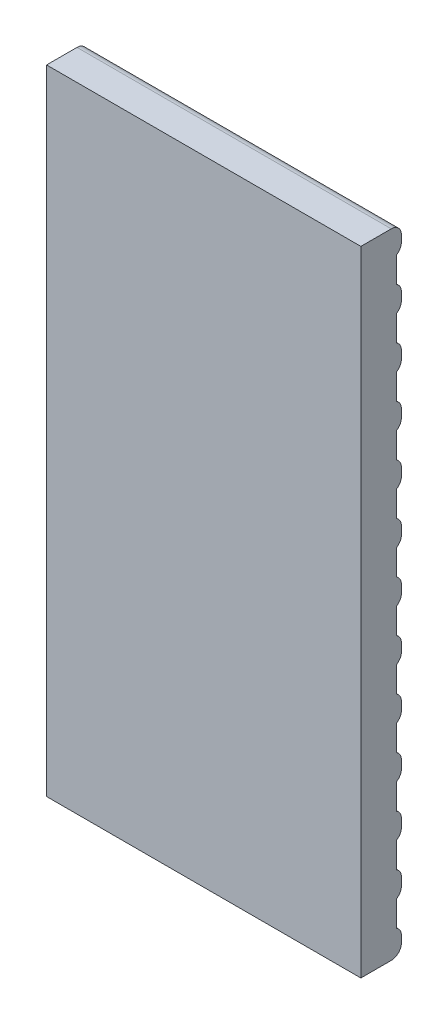
from build123d import *

# Parameters (mm, degrees)
SKETCH1_W           = 15.748
SKETCH1_H           = 31.75
BOSS_EXTRUDE1_DEPTH = 1.778
SKETCH2_W           = 15.748
SKETCH2_H           = 1.27
BOSS_EXTRUDE2_DEPTH = 0.254
FILLET1_R           = 0.508


with BuildPart() as part:
    # Sketch1 → Boss-Extrude1 (new body)
    with BuildSketch(Plane.XY):
        Rectangle(SKETCH1_W, SKETCH1_H)
    extrude(amount=BOSS_EXTRUDE1_DEPTH)

    # Sketch2 → Boss-Extrude2 (add)
    with BuildSketch(Plane(origin=(0, 0, 0), x_dir=(-1, 0, 0), z_dir=(0, 0, -1))):
        with Locations((0, -15.24)):
            Rectangle(SKETCH2_W, SKETCH2_H)
        with Locations((0, -12.7)):
            Rectangle(SKETCH2_W, SKETCH2_H)
        with Locations((0, -10.16)):
            Rectangle(SKETCH2_W, SKETCH2_H)
        with Locations((0, -7.62)):
            Rectangle(SKETCH2_W, SKETCH2_H)
        with Locations((0, -5.08)):
            Rectangle(SKETCH2_W, SKETCH2_H)
        with Locations((0, -2.54)):
            Rectangle(SKETCH2_W, SKETCH2_H)
        Rectangle(SKETCH2_W, SKETCH2_H)
        with Locations((0, 2.54)):
            Rectangle(SKETCH2_W, SKETCH2_H)
        with Locations((0, 5.08)):
            Rectangle(SKETCH2_W, SKETCH2_H)
        with Locations((0, 7.62)):
            Rectangle(SKETCH2_W, SKETCH2_H)
        with Locations((0, 10.16)):
            Rectangle(SKETCH2_W, SKETCH2_H)
        with Locations((0, 12.7)):
            Rectangle(SKETCH2_W, SKETCH2_H)
        with Locations((0, 15.24)):
            Rectangle(SKETCH2_W, SKETCH2_H)
    extrude(amount=BOSS_EXTRUDE2_DEPTH)

    # Fillet1
    # the kernel refuses this fillet: 0.508 mm, written as the material it takes off along each edge
    with BuildSketch(Plane(origin=(9.144, 15.875, -0.254), x_dir=(0, 0, 1), z_dir=(-1, 0, 0))) as fillet1_piece_1:
        with BuildLine():
            CenterArc((FILLET1_R, -FILLET1_R), FILLET1_R, 90, 90)
            Line((0, -FILLET1_R), (-FILLET1_R * 0.02, -FILLET1_R))
            Line((-FILLET1_R * 0.02, -FILLET1_R), (-FILLET1_R * 0.02, FILLET1_R * 0.02))
            Line((-FILLET1_R * 0.02, FILLET1_R * 0.02), (FILLET1_R, FILLET1_R * 0.02))
            Line((FILLET1_R, FILLET1_R * 0.02), (FILLET1_R, 0))
        make_face()
    extrude(amount=18.288, mode=Mode.SUBTRACT)
    with BuildSketch(Plane(origin=(-8.973852263, 14.605, -0.254), x_dir=(0, 0, 1), z_dir=(1, 0, 0)), Plane(origin=(-8.973852263, 12.065, -0.254), x_dir=(0, 0, 1), z_dir=(1, 0, 0)), Plane(origin=(-8.973852263, 9.525, -0.254), x_dir=(0, 0, 1), z_dir=(1, 0, 0)), Plane(origin=(-8.973852263, 6.985, -0.254), x_dir=(0, 0, 1), z_dir=(1, 0, 0)), Plane(origin=(-8.973852263, 4.445, -0.254), x_dir=(0, 0, 1), z_dir=(1, 0, 0)), Plane(origin=(-8.973852263, 1.905, -0.254), x_dir=(0, 0, 1), z_dir=(1, 0, 0)), Plane(origin=(-8.973852263, -0.635, -0.254), x_dir=(0, 0, 1), z_dir=(1, 0, 0)), Plane(origin=(-8.973852263, -3.175, -0.254), x_dir=(0, 0, 1), z_dir=(1, 0, 0)), Plane(origin=(-8.973852263, -5.715, -0.254), x_dir=(0, 0, 1), z_dir=(1, 0, 0)), Plane(origin=(-8.973852263, -8.255, -0.254), x_dir=(0, 0, 1), z_dir=(1, 0, 0)), Plane(origin=(-8.973852263, -10.795, -0.254), x_dir=(0, 0, 1), z_dir=(1, 0, 0)), Plane(origin=(-8.973852263, -13.335, -0.254), x_dir=(0, 0, 1), z_dir=(1, 0, 0))) as fillet1_piece_2:
        with BuildLine():
            CenterArc((0.508, -0.439940905), FILLET1_R, 120, 60)
            Line((0, -0.439940905), (-0.01016, -0.439940905))
            Line((-0.01016, -0.439940905), (-0.01016, 0))
            Line((-0.01016, 0), (0, 0.01016))
            ThreePointArc((0, 0.01016), (0.127, 0.01016), (0.24892, 0.008798818))
            Line((0.24892, 0.008798818), (0.254, 0))
        make_face()
    extrude(amount=17.947704526, mode=Mode.SUBTRACT)
    with BuildSketch(Plane(origin=(8.973852263, 13.335, -0.254), x_dir=(0, -1, 0), z_dir=(-1, 0, 0)), Plane(origin=(8.973852263, 10.795, -0.254), x_dir=(0, -1, 0), z_dir=(-1, 0, 0)), Plane(origin=(8.973852263, 8.255, -0.254), x_dir=(0, -1, 0), z_dir=(-1, 0, 0)), Plane(origin=(8.973852263, 5.715, -0.254), x_dir=(0, -1, 0), z_dir=(-1, 0, 0)), Plane(origin=(8.973852263, 3.175, -0.254), x_dir=(0, -1, 0), z_dir=(-1, 0, 0)), Plane(origin=(8.973852263, 0.635, -0.254), x_dir=(0, -1, 0), z_dir=(-1, 0, 0)), Plane(origin=(8.973852263, -1.905, -0.254), x_dir=(0, -1, 0), z_dir=(-1, 0, 0)), Plane(origin=(8.973852263, -4.445, -0.254), x_dir=(0, -1, 0), z_dir=(-1, 0, 0)), Plane(origin=(8.973852263, -6.985, -0.254), x_dir=(0, -1, 0), z_dir=(-1, 0, 0)), Plane(origin=(8.973852263, -9.525, -0.254), x_dir=(0, -1, 0), z_dir=(-1, 0, 0)), Plane(origin=(8.973852263, -12.065, -0.254), x_dir=(0, -1, 0), z_dir=(-1, 0, 0))) as fillet1_piece_3:
        with BuildLine():
            CenterArc((0.439940905, 0.508), FILLET1_R, 210, 60)
            Line((0, 0.254), (-0.008798818, 0.24892))
            ThreePointArc((-0.008798818, 0.24892), (-0.01016, 0.127), (-0.01016, 0))
            Line((-0.01016, 0), (0, -0.01016))
            Line((0, -0.01016), (0.439940905, -0.01016))
            Line((0.439940905, -0.01016), (0.439940905, 0))
        make_face()
    extrude(amount=17.947704526, mode=Mode.SUBTRACT)
    with BuildSketch(Plane(origin=(9.144, -15.875, -0.254), x_dir=(0, 0, 1), z_dir=(-1, 0, 0))) as fillet1_piece_4:
        with BuildLine():
            CenterArc((FILLET1_R, FILLET1_R), FILLET1_R, 180, 90)
            Line((0, FILLET1_R), (-FILLET1_R * 0.02, FILLET1_R))
            Line((-FILLET1_R * 0.02, FILLET1_R), (-FILLET1_R * 0.02, -FILLET1_R * 0.02))
            Line((-FILLET1_R * 0.02, -FILLET1_R * 0.02), (FILLET1_R, -FILLET1_R * 0.02))
            Line((FILLET1_R, -FILLET1_R * 0.02), (FILLET1_R, 0))
        make_face()
    extrude(amount=18.288, mode=Mode.SUBTRACT)
    with BuildSketch(Plane(origin=(-8.973852263, -14.605, -0.254), x_dir=(0, -1, 0), z_dir=(1, 0, 0))) as fillet1_piece_5:
        with BuildLine():
            CenterArc((0.439940905, -0.508), FILLET1_R, 90, 60)
            Line((0, -0.254), (-0.008798818, -0.24892))
            ThreePointArc((-0.008798818, -0.24892), (-0.01016, -0.127), (-0.01016, 0))
            Line((-0.01016, 0), (0, 0.01016))
            Line((0, 0.01016), (0.439940905, 0.01016))
            Line((0.439940905, 0.01016), (0.439940905, 0))
        make_face()
    extrude(amount=17.947704526, mode=Mode.SUBTRACT)


solid = part.part
